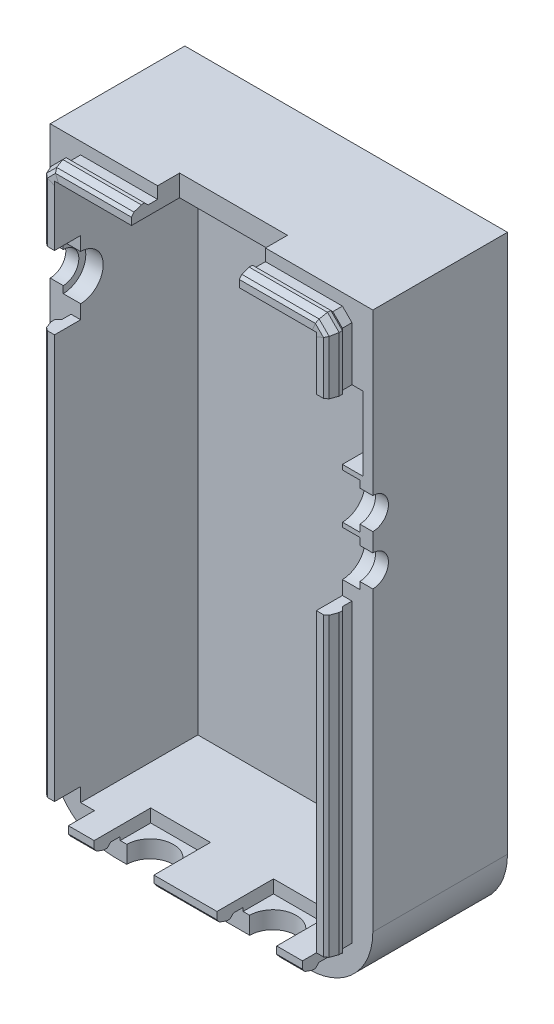
from build123d import *

# Parameters (mm, degrees)
BOSS_EXTRUDE1_DEPTH     = 18.48
SKETCH3_W               = 30.099980533
SKETCH3_H               = 63.389983028
CUT_EXTRUDE1_DEPTH      = 16.48
CUT_EXTRUDE3_DEPTH      = 103.48
CUT_EXTRUDE4_DEPTH      = 103.48
CUT_EXTRUDE5_DEPTH      = 54.54
CUT_EXTRUDE6_DEPTH      = 10
SKETCH11_W              = 2.999998629
SKETCH11_H              = 20.697738044
CUT_EXTRUDE7_DEPTH      = 10
SKETCH12_R              = 1.792950556
CUT_EXTRUDE8_DEPTH      = 10
CUT_EXTRUDE9_DEPTH      = 10
CUT_EXTRUDE9_DEPTH_BACK = 13.480001
SKETCH13_W              = 4.166997139
SKETCH13_H              = 8.430000395
SKETCH14_R              = 2.597288525
CUT_EXTRUDE10_DEPTH     = 2
SKETCH15_W              = 12.299997266
SKETCH15_H              = 5.529999733
CUT_EXTRUDE11_DEPTH     = 21
SKETCH16_R              = 1.792950556
CUT_EXTRUDE12_DEPTH     = 21
SKETCH17_W              = 2.999998645
SKETCH17_H              = 8.287733437
CUT_EXTRUDE13_DEPTH     = 21
SKETCH18_R              = 2.594885252
CUT_EXTRUDE14_DEPTH     = 2
SKETCH20_W              = 6.770000094
SKETCH20_H              = 1.500006354
CUT_EXTRUDE15_DEPTH     = 3.5
CUT_EXTRUDE16_DEPTH     = 2.999998629
SKETCH23_W              = 3.697606461
SKETCH23_H              = 2.985965669
CUT_EXTRUDE18_DEPTH     = 8.5
CUT_EXTRUDE19_DEPTH     = 0.05
CUT_EXTRUDE20_DEPTH     = 0.05
CUT_EXTRUDE21_DEPTH     = 0.05
CUT_EXTRUDE22_START     = -0.05
CUT_EXTRUDE22_DEPTH     = 0.05
CUT_EXTRUDE23_DEPTH     = 0.05
CUT_EXTRUDE24_DEPTH     = 0.05
CUT_EXTRUDE25_DEPTH     = 0.05
CUT_EXTRUDE26_DEPTH     = 0.05
CUT_EXTRUDE27_DEPTH     = 0.05
CUT_EXTRUDE28_START     = -0.05
CUT_EXTRUDE28_DEPTH     = 0.05
CUT_EXTRUDE29_DEPTH     = 0.05
CUT_EXTRUDE30_DEPTH     = 0.05
CUT_EXTRUDE31_DEPTH     = 0.05
CUT_EXTRUDE32_DEPTH     = 0.05
CUT_EXTRUDE33_DEPTH     = 11.05
CUT_EXTRUDE34_DEPTH     = 11.05


# Read off the part's stored shape, not the designer's step: Cut-Extrude16, Cut-Extrude22, Cut-Extrude28
with BuildPart() as part:
    # Sketch1 → Boss-Extrude1 (new body)
    with BuildSketch(Plane.XY):
        with BuildLine():
            Line((18.546197564, -27.263243275), (18.546197564, 34.673092364))
            Line((18.546197564, 34.673092364), (-18.546197564, 34.673092364))
            Line((-18.546197564, 34.673092364), (-18.546197564, -27.263243275))
            ThreePointArc((-18.546197564, -27.263243275), (-16.375903013, -32.502797813), (-11.136348475, -34.673092364))
            Line((-11.136348475, -34.673092364), (11.136348475, -34.673092364))
            ThreePointArc((11.136348475, -34.673092364), (16.375903013, -32.502797813), (18.546197564, -27.263243275))
        make_face()
    extrude(amount=BOSS_EXTRUDE1_DEPTH)

    # Sketch3 → Cut-Extrude1 (cut)
    with BuildSketch(Plane.XY.offset(18.48)):
        with Locations((-1.1177e-05, 0.518105401)):
            Rectangle(SKETCH3_W, SKETCH3_H)
    extrude(amount=-CUT_EXTRUDE1_DEPTH, mode=Mode.SUBTRACT)

    # Sketch5 → Cut-Extrude3 (cut)
    with BuildSketch(Plane.XZ.offset(34.673092364)):
        Polygon((16.150001437, 15.480001371), (18.546197564, 15.480001371), (18.546197564, 18.48), (15.875000507, 18.48), (16.249999404, 18.200001593), (16.550000757, 17.360000785), (16.550000757, 16.980000685), (16.150001437, 16.580001365), align=None)
    cut_extrude3 = extrude(amount=-CUT_EXTRUDE3_DEPTH, mode=Mode.SUBTRACT)

    # Mirror2: Cut-Extrude3 across plane
    add(cut_extrude3.mirror(Plane(origin=(0, 0, 0), x_dir=(0, 0, 1), z_dir=(1, 0, 0))), mode=Mode.SUBTRACT)

    # Sketch6 → Cut-Extrude4 (cut)
    with BuildSketch(Plane.ZY.offset(18.546197564)):
        Polygon((15.48000154, -32.276896237), (15.48000154, -34.673092364), (18.48, -34.673092364), (18.48, -32.001895942), (18.200001593, -32.376894839), (17.360000785, -32.676892467), (16.980000685, -32.676892467), (16.580002, -32.276896237), align=None)
    extrude(amount=-CUT_EXTRUDE4_DEPTH, mode=Mode.SUBTRACT)

    # Sketch8 → Cut-Extrude5 (cut)
    with BuildSketch(Plane.ZY.offset(18.546197564)):
        Polygon((15.480001371, 33.313093184), (15.480001371, 34.673092364), (18.48, 34.673092364), (18.48, 33.038092254), (18.200001593, 33.413091151), (17.360000785, 33.713092504), (16.980000685, 33.713092504), (16.580001365, 33.313093184), align=None)
    extrude(amount=-CUT_EXTRUDE5_DEPTH, mode=Mode.SUBTRACT)

    # Sketch9 → Cut-Extrude6 (cut)
    with BuildSketch(Plane.XZ.offset(34.673092364)):
        with BuildLine():
            Line((-10.44518366, 18.480000048), (-3.675183566, 18.480000048))
            Line((-3.675183566, 18.480000048), (-3.675183566, 15.480001419))
            Line((-3.675183566, 15.480001419), (-4.384112223, 15.480001419))
            ThreePointArc((-4.384112223, 15.480001419), (-7.060183613, 12.803930029), (-9.736255003, 15.480001419))
            Line((-9.736255003, 15.480001419), (-10.44518366, 15.480001419))
            Line((-10.44518366, 15.480001419), (-10.44518366, 18.480000048))
        make_face()
    cut_extrude6 = extrude(amount=-CUT_EXTRUDE6_DEPTH, mode=Mode.SUBTRACT)

    # Mirror3: Cut-Extrude6 across plane
    add(cut_extrude6.mirror(Plane(origin=(0, 0, 0), x_dir=(0, 0, 1), z_dir=(1, 0, 0))), mode=Mode.SUBTRACT)

    # Sketch11 → Cut-Extrude7 (cut)
    with BuildSketch(Plane(origin=(18.546197564, 0, 0), x_dir=(0, 0, -1), z_dir=(1, 0, 0))):
        with Locations((-16.980000686, 14.89309402)):
            Rectangle(SKETCH11_W, SKETCH11_H)
    extrude(amount=-CUT_EXTRUDE7_DEPTH, mode=Mode.SUBTRACT)

    # Sketch12 → Cut-Extrude8 (cut)
    with BuildSketch(Plane(origin=(18.546197564, 0, 0), x_dir=(0, 0, -1), z_dir=(1, 0, 0))):
        with Locations((-15.479999974, 14.398097469)):
            Circle(SKETCH12_R)
        with Locations((-15.479999974, 8.688099159)):
            Circle(SKETCH12_R)
    extrude(amount=-CUT_EXTRUDE8_DEPTH, mode=Mode.SUBTRACT)

    # Sketch13 → Cut-Extrude9 (cut, two sides: drawn at the far end of the back side and taken through both)
    with BuildSketch(Plane.XY.offset(15.480001371).offset(-CUT_EXTRUDE9_DEPTH_BACK)):
        with Locations((15.316501675, 21.768090724)):
            Rectangle(SKETCH13_W, SKETCH13_H)
    extrude(amount=CUT_EXTRUDE9_DEPTH + CUT_EXTRUDE9_DEPTH_BACK, mode=Mode.SUBTRACT)

    # Sketch14 → Cut-Extrude10 (cut)
    with BuildSketch(Plane.ZY.offset(-15.04997909)):
        with Locations((15.479999974, 14.398097469)):
            Circle(SKETCH14_R)
        with Locations((15.479999974, 8.688099159)):
            Circle(SKETCH14_R)
    extrude(amount=-CUT_EXTRUDE10_DEPTH, mode=Mode.SUBTRACT)

    # Sketch15 → Cut-Extrude11 (cut)
    with BuildSketch(Plane(origin=(0, 34.673092364, 0), x_dir=(1, 0, 0), z_dir=(0, 1, 0))):
        with Locations((0, -15.715000134)):
            Rectangle(SKETCH15_W, SKETCH15_H)
    extrude(amount=-CUT_EXTRUDE11_DEPTH, mode=Mode.SUBTRACT)

    # Sketch16 → Cut-Extrude12 (cut)
    with BuildSketch(Plane.ZY.offset(18.546197564)):
        with Locations(Location((15.480001371, 21.0980954, 0), (0, 0, 270))):
            Circle(SKETCH16_R)
    extrude(amount=-CUT_EXTRUDE12_DEPTH, mode=Mode.SUBTRACT)

    # Sketch17 → Cut-Extrude13 (cut)
    with BuildSketch(Plane.ZY.offset(18.546197564)):
        with Locations((16.980000839, 21.098096485)):
            Rectangle(SKETCH17_W, SKETCH17_H)
    extrude(amount=-CUT_EXTRUDE13_DEPTH, mode=Mode.SUBTRACT)

    # Sketch18 → Cut-Extrude14 (cut)
    with BuildSketch(Plane(origin=(-15.050001443, 0, 0), x_dir=(0, 0, -1), z_dir=(1, 0, 0))):
        with Locations((-15.480001371, 21.0980954)):
            Circle(SKETCH18_R)
    extrude(amount=-CUT_EXTRUDE14_DEPTH, mode=Mode.SUBTRACT)

    # Sketch20 → Cut-Extrude15 (cut)
    with BuildSketch(Plane.XY.offset(15.480001371)):
        with Locations((7.060183613, -31.92688929)):
            Rectangle(SKETCH20_W, SKETCH20_H)
        with Locations((-7.060183613, -31.92688929)):
            Rectangle(SKETCH20_W, SKETCH20_H)
    extrude(amount=-CUT_EXTRUDE15_DEPTH, mode=Mode.SUBTRACT)

    # Cut-Extrude16 outline → Cut-Extrude16 (cut)
    with BuildSketch(Plane.XY.offset(15.480001371)):
        with BuildLine():
            Line((13.505182746, -32.676892467), (16.195821367, -32.676892467))
            ThreePointArc((16.195821367, -32.676892467), (16.375904613, -32.502796213), (16.550000757, -32.32271286))
            Line((16.550000757, -32.32271286), (16.550000757, -29.626887815))
            Line((16.550000757, -29.626887815), (15.04997909, -29.626887815))
            Line((15.04997909, -29.626887815), (15.04997909, -31.176886113))
            Line((15.04997909, -31.176886113), (13.505182746, -31.176886113))
            Line((13.505182746, -31.176886113), (13.505182746, -32.676892467))
        make_face()
    cut_extrude16 = extrude(amount=CUT_EXTRUDE16_DEPTH, mode=Mode.SUBTRACT)

    # Mirror4: Cut-Extrude16 across plane
    add(cut_extrude16.mirror(Plane(origin=(0, 0, 0), x_dir=(0, 0, 1), z_dir=(1, 0, 0))), mode=Mode.SUBTRACT)

    # Sketch23 → Cut-Extrude18 (cut)
    with BuildSketch(Plane.XY.offset(15.480001371)):
        with Locations((15.300246124, 32.22010967)):
            Rectangle(SKETCH23_W, SKETCH23_H)
    cut_extrude18 = extrude(amount=CUT_EXTRUDE18_DEPTH, mode=Mode.SUBTRACT)

    # Sweep1: sweep along a path in Sketch24
    with BuildLine(Plane.XY.offset(15.480001371)) as sweep1_path:
        Line((16.150001437, 30.727126835), (16.150001437, 32.21309319))
        Line((16.150001437, 32.21309319), (15.050000511, 33.313093184))
        Line((15.050000511, 33.313093184), (13.451442893, 33.313093184))
    # Sketch25 → Sweep1 (sweep)
    with BuildSketch(Plane(origin=(0, 30.727126835, 0), x_dir=(1, 0, 0), z_dir=(0, 1, 0))):
        Polygon((16.150001437, -16.580001365), (16.150001437, -15.480001371), (15.04997909, -15.480001371), (15.04997909, -18.48), (15.875000507, -18.48), (16.249999404, -18.200001593), (16.550000757, -17.360000785), (16.550000757, -16.980000685), align=None)
    sweep1 = sweep(path=sweep1_path.line, transition=Transition.RIGHT)

    # Mirror6: Cut-Extrude18, Sweep1 across plane
    add(cut_extrude18.mirror(Plane(origin=(0, 0, 0), x_dir=(0, 0, 1), z_dir=(1, 0, 0))), mode=Mode.SUBTRACT)
    add(sweep1.mirror(Plane(origin=(0, 0, 0), x_dir=(0, 0, 1), z_dir=(1, 0, 0))))

    # Sketch26 → Cut-Extrude19 (cut)
    with BuildSketch(Plane.XZ.offset(-25.241963203)):
        Polygon((-15.050001443, 18.480000161), (-15.875000291, 18.480000161), (-16.249999404, 18.200001593), (-16.550000757, 17.360000785), (-16.550000757, 16.980000685), (-16.150001437, 16.580001365), (-16.150001437, 15.480001516), (-15.050001443, 15.480001516), align=None)
    extrude(amount=-CUT_EXTRUDE19_DEPTH, mode=Mode.SUBTRACT)

    # Sketch27 → Cut-Extrude20 (cut)
    with BuildSketch(Plane(origin=(0, 16.954229766, 0), x_dir=(1, 0, 0), z_dir=(0, 1, 0))):
        Polygon((-15.050001443, -15.480001516), (-16.150001437, -15.480001516), (-16.150001437, -16.580001365), (-16.550000757, -16.980000685), (-16.550000757, -17.360000785), (-16.249999404, -18.200001593), (-15.875000291, -18.480000161), (-15.050001443, -18.480000161), align=None)
    extrude(amount=-CUT_EXTRUDE20_DEPTH, mode=Mode.SUBTRACT)

    # Sketch28 → Cut-Extrude21 (cut)
    with BuildSketch(Plane.XZ.offset(29.626887815)):
        Polygon((-15.050001443, 18.48), (-15.875000507, 18.48), (-16.249999404, 18.200001593), (-16.550000757, 17.360000785), (-16.550000757, 16.980000685), (-16.150001437, 16.580001365), (-16.150001437, 15.480001371), (-15.050001443, 15.480001371), align=None)
    extrude(amount=-CUT_EXTRUDE21_DEPTH, mode=Mode.SUBTRACT)

    # Cut-Extrude22 outline → Cut-Extrude22 (cut)
    with BuildSketch(Plane.ZY.offset(13.505182746).offset(CUT_EXTRUDE22_START)):
        Polygon((18.200001593, -32.376894839), (18.480000048, -32.001895878), (18.48, -31.176886113), (15.480001371, -31.176886113), (15.480001371, -32.276896237), (16.580002, -32.276896237), (16.980000685, -32.676892467), (17.360004046, -32.676892467), align=None)
    extrude(amount=CUT_EXTRUDE22_DEPTH, mode=Mode.SUBTRACT)

    # Sketch30 → Cut-Extrude23 (cut)
    with BuildSketch(Plane.XZ.offset(29.626887815)):
        Polygon((15.04997909, 15.480001371), (16.150001437, 15.480001371), (16.150001437, 16.580001365), (16.550000757, 16.980000685), (16.550000757, 17.360000785), (16.249999404, 18.200001593), (15.875000507, 18.48), (15.04997909, 18.48), align=None)
    extrude(amount=-CUT_EXTRUDE23_DEPTH, mode=Mode.SUBTRACT)

    # Sketch31 → Cut-Extrude24 (cut)
    with BuildSketch(Plane(origin=(-10.44518366, 0, 0), x_dir=(0, 0, -1), z_dir=(1, 0, 0))):
        Polygon((-11.980001371, -31.176886113), (-18.480000048, -31.176886113), (-18.480000048, -32.001895878), (-18.200001593, -32.376894839), (-17.360000785, -32.676892467), (-16.980000685, -32.676892467), (-16.580002, -32.276896237), (-15.480001371, -32.276896237), (-15.480001371, -32.676892467), (-11.980001371, -32.676892467), align=None)
    extrude(amount=-CUT_EXTRUDE24_DEPTH, mode=Mode.SUBTRACT)

    # Sketch32 → Cut-Extrude25 (cut)
    with BuildSketch(Plane.ZY.offset(3.675183566)):
        Polygon((18.480000048, -31.176886113), (11.980001371, -31.176886113), (11.980001371, -32.676892467), (15.480001371, -32.676892467), (15.480001371, -32.276896237), (16.580002, -32.276896237), (16.980000685, -32.676892467), (17.360000785, -32.676892467), (18.200001593, -32.376894839), (18.480000048, -32.001895878), align=None)
    extrude(amount=-CUT_EXTRUDE25_DEPTH, mode=Mode.SUBTRACT)

    # Sketch33 → Cut-Extrude26 (cut)
    with BuildSketch(Plane(origin=(3.675183566, 0, 0), x_dir=(0, 0, -1), z_dir=(1, 0, 0))):
        Polygon((-18.480000048, -31.176886113), (-18.480000048, -32.001895878), (-18.200001593, -32.376894839), (-17.360000785, -32.676892467), (-16.980000685, -32.676892467), (-16.580002, -32.276896237), (-15.480001371, -32.276896237), (-15.480001371, -32.676892467), (-11.980001371, -32.676892467), (-11.980001371, -31.176886113), align=None)
    extrude(amount=-CUT_EXTRUDE26_DEPTH, mode=Mode.SUBTRACT)

    # Sketch34 → Cut-Extrude27 (cut)
    with BuildSketch(Plane.ZY.offset(-10.44518366)):
        Polygon((18.480000048, -31.176886113), (11.980001371, -31.176886113), (11.980001371, -32.676892467), (15.480001371, -32.676892467), (15.480001371, -32.276896237), (16.580002, -32.276896237), (16.980000685, -32.676892467), (17.360000785, -32.676892467), (18.200001593, -32.376894839), (18.480000048, -32.001895878), align=None)
    extrude(amount=-CUT_EXTRUDE27_DEPTH, mode=Mode.SUBTRACT)

    # Cut-Extrude28 outline → Cut-Extrude28 (cut)
    with BuildSketch(Plane(origin=(13.505182746, 0, 0), x_dir=(0, 0, -1), z_dir=(1, 0, 0)).offset(CUT_EXTRUDE28_START)):
        Polygon((-15.480001371, -31.176886113), (-18.480000048, -31.176886113), (-18.48, -32.001895942), (-18.200001593, -32.376894839), (-17.360000785, -32.676892467), (-16.980000685, -32.676892467), (-16.580002, -32.276896237), (-15.480001371, -32.276896237), align=None)
    extrude(amount=CUT_EXTRUDE28_DEPTH, mode=Mode.SUBTRACT)

    # Sketch36 → Cut-Extrude29 (cut)
    with BuildSketch(Plane(origin=(0, 4.544224998, 0), x_dir=(1, 0, 0), z_dir=(0, 1, 0))):
        Polygon((15.04997909, -15.480001371), (15.04997909, -18.48), (15.875000507, -18.48), (16.249999404, -18.200001593), (16.550000757, -17.360000785), (16.550000757, -16.980000685), (16.150001437, -16.580001365), (16.150001437, -15.480001371), align=None)
    extrude(amount=-CUT_EXTRUDE29_DEPTH, mode=Mode.SUBTRACT)

    # Sketch37 → Cut-Extrude30 (cut)
    with BuildSketch(Plane.XZ.offset(-25.983090921)):
        Polygon((17.400000245, 15.480001371), (16.150001437, 15.480001371), (16.150001437, 16.580001365), (16.550000757, 16.980000685), (16.550000757, 17.360000785), (16.249999404, 18.200001593), (15.875000507, 18.48), (15.04997909, 18.48), (15.04997909, 2), (17.400000245, 2), align=None)
    extrude(amount=-CUT_EXTRUDE30_DEPTH, mode=Mode.SUBTRACT)

    # Sketch38 → Cut-Extrude31 (cut)
    with BuildSketch(Plane(origin=(-6.149998633, 0, 0), x_dir=(0, 0, -1), z_dir=(1, 0, 0))):
        Polygon((-12.950000267, 32.213096915), (-12.950000267, 34.673092364), (-15.480001371, 34.673092364), (-15.480001371, 33.313093184), (-16.580001365, 33.313093184), (-16.980000685, 33.713092504), (-17.360000785, 33.713092504), (-18.200001593, 33.413091151), (-18.48, 33.038092254), (-18.48, 32.213096915), align=None)
    extrude(amount=-CUT_EXTRUDE31_DEPTH, mode=Mode.SUBTRACT)

    # Sketch39 → Cut-Extrude32 (cut)
    with BuildSketch(Plane.ZY.offset(-6.149998633)):
        Polygon((18.48, 32.213096915), (18.48, 33.038092254), (18.200001593, 33.413091151), (17.360000785, 33.713092504), (16.980000685, 33.713092504), (16.580001365, 33.313093184), (15.480001371, 33.313093184), (15.480001371, 34.673092364), (12.950000267, 34.673092364), (12.950000267, 32.213096915), align=None)
    extrude(amount=-CUT_EXTRUDE32_DEPTH, mode=Mode.SUBTRACT)

    # Sketch41 → Cut-Extrude33 (cut)
    with BuildSketch(Plane(origin=(0, 0, 15.480001371), x_dir=(-1, 0, 0), z_dir=(0, 0, -1))):
        Polygon((-13.451442893, 32.213070838), (-15.04997909, 32.213096915), (-15.04997909, 31.544283758), (-12.912088878, 30.446738359), align=None)
    extrude(amount=-CUT_EXTRUDE33_DEPTH, mode=Mode.SUBTRACT)

    # Sketch42 → Cut-Extrude34 (cut)
    with BuildSketch(Plane(origin=(0, 0, 15.480001371), x_dir=(-1, 0, 0), z_dir=(0, 0, -1))):
        Polygon((13.451442893, 32.213070838), (15.050001443, 32.213096915), (15.050001443, 29.734697946), align=None)
    extrude(amount=-CUT_EXTRUDE34_DEPTH, mode=Mode.SUBTRACT)


solid = part.part
